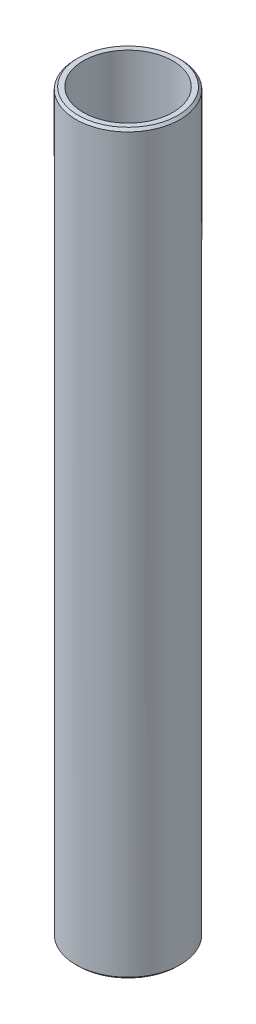
from build123d import *

# Parameters (mm, degrees)
SKETCH1_R           = 42.5
BOSS_EXTRUDE1_DEPTH = 600
SKETCH2_R           = 36.448886846
CUT_EXTRUDE1_DEPTH  = 604.002902149
CHAMFER1_SIZE       = 1.930507413


with BuildPart() as part:
    # Sketch1 → Boss-Extrude1 (new body)
    with BuildSketch(Plane(origin=(0, 0, 0), x_dir=(1, 0, 0), z_dir=(0, 1, 0))):
        Circle(SKETCH1_R)
    extrude(amount=BOSS_EXTRUDE1_DEPTH)

    # Sketch2 → Cut-Extrude1 (cut, through all)
    with BuildSketch(Plane(origin=(0, 0, 0), x_dir=(1, 0, 0), z_dir=(0, 1, 0))):
        Circle(SKETCH2_R)
    extrude(amount=CUT_EXTRUDE1_DEPTH, mode=Mode.SUBTRACT)

    # Chamfer1
    chamfer1_edges = [part.edges().sort_by_distance(p)[0] for p in [
        (-42.5, 600, 0),
        (-42.5, 0, 0),
    ]]
    chamfer(chamfer1_edges, length=CHAMFER1_SIZE)


solid = part.part
